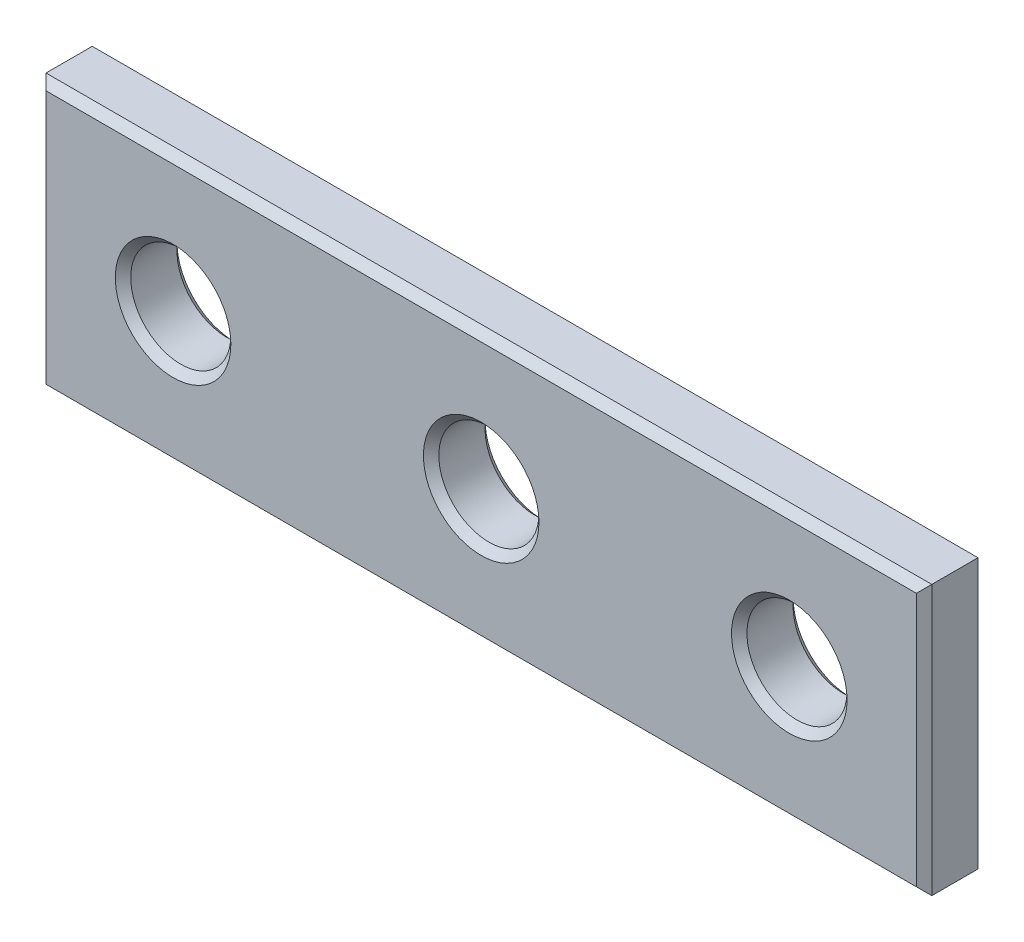
from build123d import *

# Parameters (mm, degrees)
SKETCH_1_W        = 230
SKETCH_1_H        = 70
SKETCH_1_R        = 13
EXTRUDE_325_DEPTH = 16
CHAMFER_1_SIZE    = 2


with BuildPart() as part:
    # 草图1 → Extrude 325 (new body)
    with BuildSketch(Plane.XY):
        Rectangle(SKETCH_1_W, SKETCH_1_H)
        Circle(SKETCH_1_R, mode=Mode.SUBTRACT)
        with Locations((80, 0)):
            Circle(SKETCH_1_R, mode=Mode.SUBTRACT)
        with Locations((-80, 0)):
            Circle(SKETCH_1_R, mode=Mode.SUBTRACT)
    extrude(amount=EXTRUDE_325_DEPTH)

    # 倒角1
    chamfer_1_edges = [part.edges().sort_by_distance(p)[0] for p in [
        (-93, 0, 0),
        (-13, 0, 0),
        (0, -35, 0),
        (115, 0, 0),
        (0, 35, 0),
        (-115, 0, 0),
        (67, 0, 0),
        (-93, 0, 16),
        (-13, 0, 16),
        (0, 35, 16),
        (115, 0, 16),
        (0, -35, 16),
        (-115, 0, 16),
        (67, 0, 16),
    ]]
    chamfer(chamfer_1_edges, length=CHAMFER_1_SIZE)


solid = part.part
